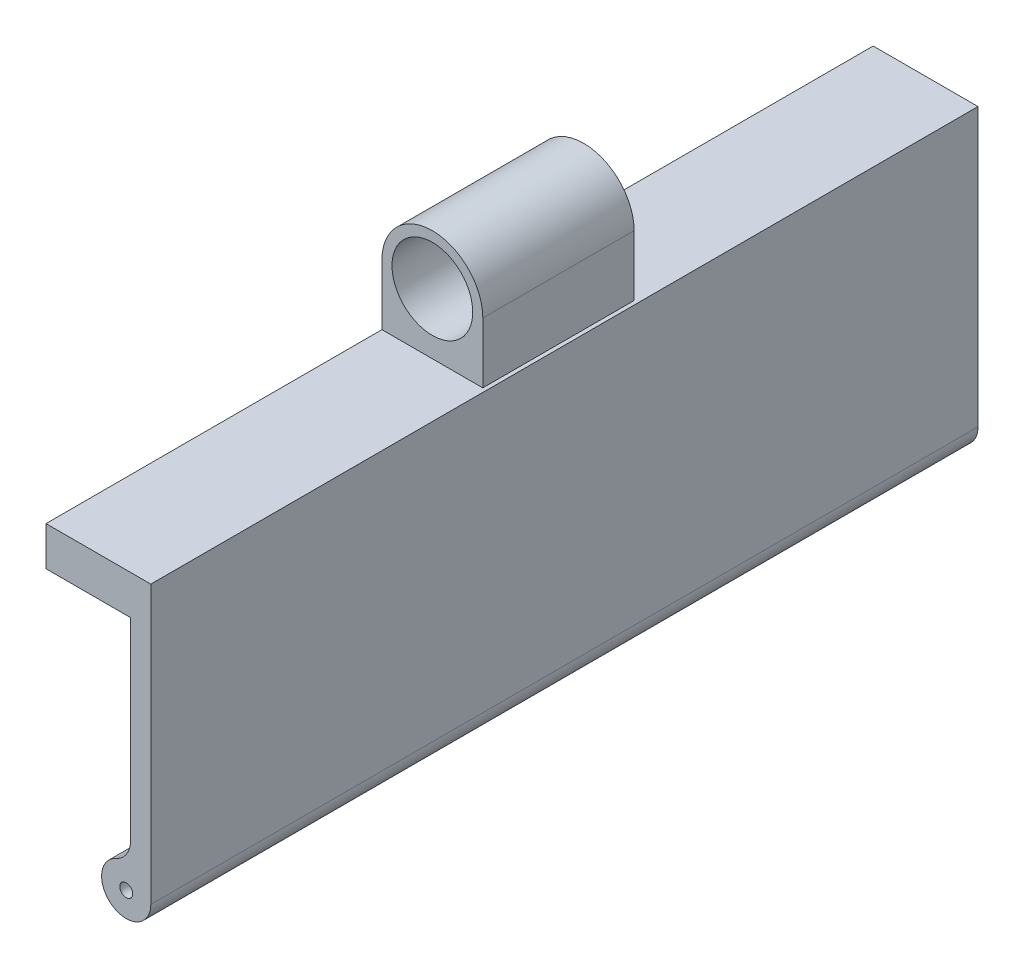
from build123d import *

# Parameters (mm, degrees)
SKETCH1_R           = 0.64
BOSS_EXTRUDE1_DEPTH = 82
SKETCH3_W           = 2
SKETCH3_H           = 82
BOSS_EXTRUDE4_DEPTH = 2.5
SKETCH6_W           = 82
SKETCH6_H           = 3.880734095
BOSS_EXTRUDE5_DEPTH = 8.39
BOSS_EXTRUDE6_START = -33.7
SKETCH8_R           = 4
BOSS_EXTRUDE6_DEPTH = 15


with BuildPart() as part:
    # Sketch1 → Boss-Extrude1 (new body)
    with BuildSketch(Plane.XY):
        with BuildLine():
            Line((2.44, 0), (2.44, 25))
            Line((2.44, 25), (0.44, 25))
            Line((0.44, 25), (0.44, 4.489988864))
            ThreePointArc((0.44, 4.489988864), (0.044314057, 3.140225052), (-1.017489879, 2.217727293))
            ThreePointArc((-1.017489879, 2.217727293), (-1.317369481, -2.05381052), (2.44, 0))
        make_face()
        Circle(SKETCH1_R, mode=Mode.SUBTRACT)
    extrude(amount=BOSS_EXTRUDE1_DEPTH)

    # Sketch3 → Boss-Extrude4 (add)
    with BuildSketch(Plane(origin=(0, 25, 0), x_dir=(1, 0, 0), z_dir=(0, 1, 0))):
        with Locations((1.44, -41)):
            Rectangle(SKETCH3_W, SKETCH3_H)
    extrude(amount=BOSS_EXTRUDE4_DEPTH)

    # Sketch6 → Boss-Extrude5 (add)
    with BuildSketch(Plane.ZY.offset(-0.44)):
        with Locations((41, 25.559632953)):
            Rectangle(SKETCH6_W, SKETCH6_H)
    extrude(amount=BOSS_EXTRUDE5_DEPTH)

    # Sketch8 → Boss-Extrude6 (add)
    with BuildSketch(Plane(origin=(0, 0, 0), x_dir=(-1, 0, 0), z_dir=(0, 0, -1)).offset(BOSS_EXTRUDE6_START)):
        with BuildLine():
            Line((7.95, 27.5), (7.95, 33.5))
            ThreePointArc((7.95, 33.5), (2.95, 38.5), (-2.05, 33.5))
            Line((-2.05, 33.5), (-2.05, 27.5))
            Line((-2.05, 27.5), (7.95, 27.5))
        make_face()
        with Locations((2.95, 33.5)):
            Circle(SKETCH8_R, mode=Mode.SUBTRACT)
    extrude(amount=-BOSS_EXTRUDE6_DEPTH)


solid = part.part
